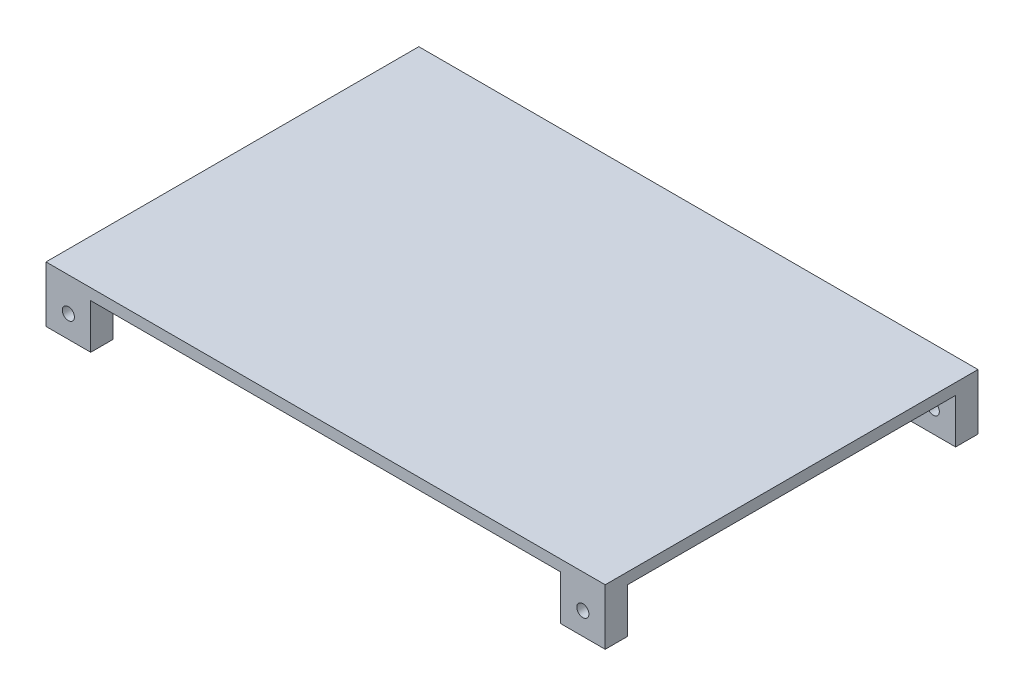
from build123d import *

# Parameters (mm, degrees)
SKETCH1_W           = 150
SKETCH1_H           = 100
BOSS_EXTRUDE1_DEPTH = 3
SKETCH2_W           = 12
SKETCH2_H           = 6
BOSS_EXTRUDE2_DEPTH = 12
SKETCH4_R           = 1.625
CUT_EXTRUDE1_DEPTH  = 181.676506497


with BuildPart() as part:
    # Sketch1 → Boss-Extrude1 (new body)
    with BuildSketch(Plane(origin=(0, 0, 0), x_dir=(1, 0, 0), z_dir=(0, 1, 0))):
        with Locations((75, 50)):
            Rectangle(SKETCH1_W, SKETCH1_H)
    extrude(amount=BOSS_EXTRUDE1_DEPTH)

    # Sketch2 → Boss-Extrude2 (add)
    with BuildSketch(Plane.XZ):
        with Locations((6, -3)):
            Rectangle(SKETCH2_W, SKETCH2_H)
        with Locations((144, -3)):
            Rectangle(SKETCH2_W, SKETCH2_H)
        with Locations((144, -97)):
            Rectangle(SKETCH2_W, SKETCH2_H)
        with Locations((6, -97)):
            Rectangle(SKETCH2_W, SKETCH2_H)
    extrude(amount=BOSS_EXTRUDE2_DEPTH)

    # Sketch4 → Cut-Extrude1 (cut, through all)
    with BuildSketch(Plane.XY):
        with Locations((6, -6)):
            Circle(SKETCH4_R)
        with Locations((144, -6)):
            Circle(SKETCH4_R)
    extrude(amount=-CUT_EXTRUDE1_DEPTH, mode=Mode.SUBTRACT)


solid = part.part
